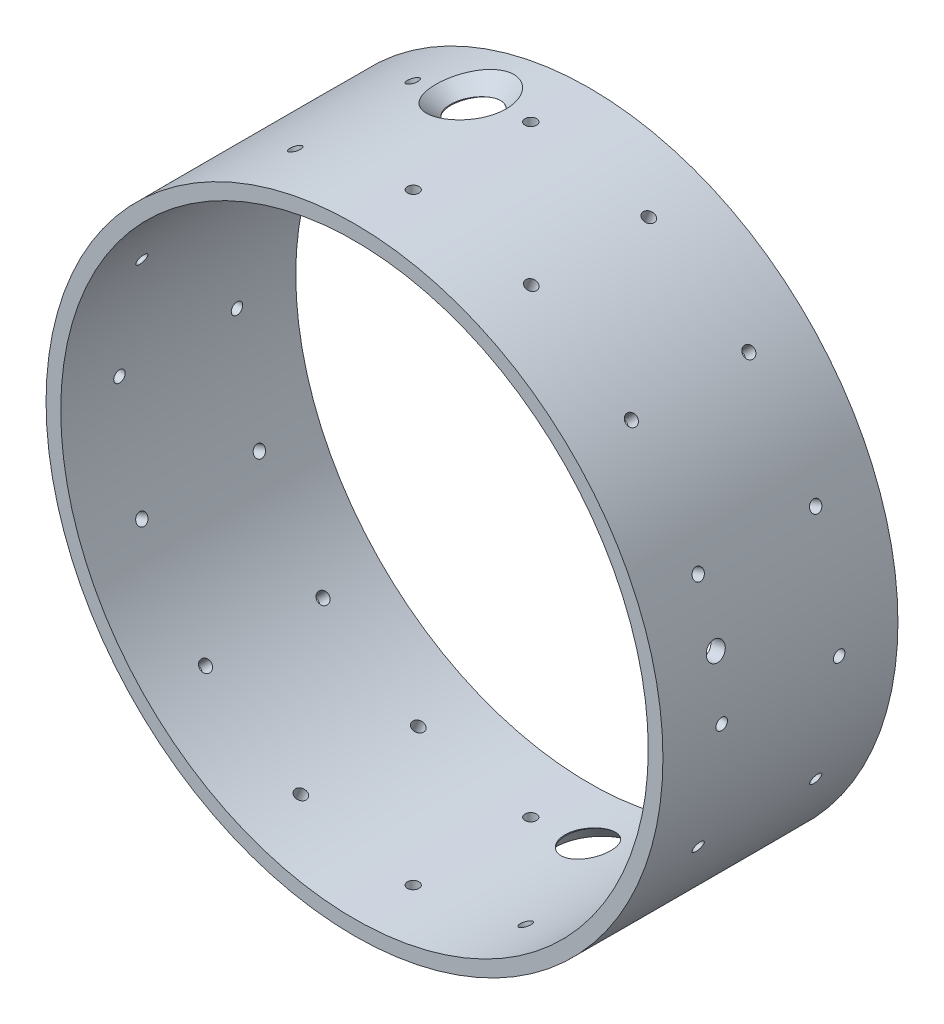
from build123d import *
from build123d.topology import SkipClean

# Parameters (mm, degrees)
SKETCH1_R                            = 66.675
SKETCH1_R_2                          = 63.5
EXTRUDE1_DEPTH                       = 50.8
F_40_0_098_DIAMETER_HOLE2_AT_2_COUNT = 2
F_40_0_098_DIAMETER_HOLE2_AT_2_PITCH = 25.4
CIRPATTERN1_COUNT                    = 16
F_10_32_TAPPED_HOLE1_D               = 4.0386
F_10_32_TAPPED_HOLE1_DEPTH           = 13.716
F_10_32_TAPPED_HOLE1_TIP             = 1.213317848


with BuildPart() as part:
    # Sketch1 → Extrude1 (new body)
    with BuildSketch(Plane.XY):
        Circle(SKETCH1_R)
        Circle(SKETCH1_R_2, mode=Mode.SUBTRACT)
    extrude(amount=EXTRUDE1_DEPTH)

    # Sketch8 → #40 (0.098) Diameter Hole2 (revolve, cut)
    with BuildSketch(Plane(origin=(0, 66.675, 12.7), x_dir=(0, 0, 1), z_dir=(1, 0, 0))):
        Polygon((0, 0), (0, 13.447831126), (1.2446, 12.7), (1.2446, 0), align=None)
    f_40_0_098_diameter_hole2 = revolve(axis=Axis((0, 73.025, 12.7), (0, -1, 0)), mode=Mode.SUBTRACT)

    # #40 (0.098) Diameter Hole2 at 2: #40 (0.098) Diameter Hole2 ×2
    with Locations(*[(0, 0, i * F_40_0_098_DIAMETER_HOLE2_AT_2_PITCH) for i in range(1, F_40_0_098_DIAMETER_HOLE2_AT_2_COUNT)]):
        add(f_40_0_098_diameter_hole2, mode=Mode.SUBTRACT)

    # CirPattern1: #40 (0.098) Diameter Hole2 ×16 about axis
    cirpattern1_axis = Axis((0, 0, 50.8), (0, 0, -1))
    for i in range(1, CIRPATTERN1_COUNT):
        add(f_40_0_098_diameter_hole2.rotate(cirpattern1_axis, i * 360 / CIRPATTERN1_COUNT), mode=Mode.SUBTRACT)

    # CirPattern1 copy 1 sketch → CirPattern1 copy 1 (revolve, cut)
    with BuildSketch(Plane(origin=(25.515417853, 61.59966783, 38.1), x_dir=(0, 0, 1), z_dir=(0.9238795325112867, -0.3826834323650898, 0))):
        Polygon((0, 0), (0, 13.447831126), (1.2446, 12.7), (1.2446, 0), align=None)
    revolve(axis=Axis((27.945457648, 67.466302862, 38.1), (-0.3826834323650898, -0.9238795325112867, 0)), mode=Mode.SUBTRACT)

    # CirPattern1 copy 2 sketch → CirPattern1 copy 2 (revolve, cut)
    with BuildSketch(Plane(origin=(47.146344636, 47.146344636, 38.1), x_dir=(0, 0, 1), z_dir=(0.7071067811865476, -0.7071067811865475, 0))):
        Polygon((0, 0), (0, 13.447831126), (1.2446, 12.7), (1.2446, 0), align=None)
    revolve(axis=Axis((51.636472696, 51.636472696, 38.1), (-0.7071067811865475, -0.7071067811865476, 0)), mode=Mode.SUBTRACT)

    # CirPattern1 copy 3 sketch → CirPattern1 copy 3 (revolve, cut)
    with BuildSketch(Plane(origin=(61.59966783, 25.515417853, 38.1), x_dir=(0, 0, 1), z_dir=(0.38268343236508984, -0.9238795325112867, 0))):
        Polygon((0, 0), (0, 13.447831126), (1.2446, 12.7), (1.2446, 0), align=None)
    revolve(axis=Axis((67.466302862, 27.945457648, 38.1), (-0.9238795325112867, -0.38268343236508984, 0)), mode=Mode.SUBTRACT)

    # CirPattern1 copy 4 sketch → CirPattern1 copy 4 (revolve, cut)
    with BuildSketch(Plane(origin=(66.675, 0, 38.1), x_dir=(0, 0, 1), z_dir=(0, -1, 0))):
        Polygon((0, 0), (0, 13.447831126), (1.2446, 12.7), (1.2446, 0), align=None)
    revolve(axis=Axis((73.025, 0, 38.1), (-1, 0, 0)), mode=Mode.SUBTRACT)

    # CirPattern1 copy 5 sketch → CirPattern1 copy 5 (revolve, cut)
    with BuildSketch(Plane(origin=(61.59966783, -25.515417853, 38.1), x_dir=(0, 0, 1), z_dir=(-0.3826834323650897, -0.9238795325112867, 0))):
        Polygon((0, 0), (0, 13.447831126), (1.2446, 12.7), (1.2446, 0), align=None)
    revolve(axis=Axis((67.466302862, -27.945457648, 38.1), (-0.9238795325112867, 0.3826834323650897, 0)), mode=Mode.SUBTRACT)

    # CirPattern1 copy 6 sketch → CirPattern1 copy 6 (revolve, cut)
    with BuildSketch(Plane(origin=(47.146344636, -47.146344636, 38.1), x_dir=(0, 0, 1), z_dir=(-0.7071067811865475, -0.7071067811865476, 0))):
        Polygon((0, 0), (0, 13.447831126), (1.2446, 12.7), (1.2446, 0), align=None)
    revolve(axis=Axis((51.636472696, -51.636472696, 38.1), (-0.7071067811865476, 0.7071067811865475, 0)), mode=Mode.SUBTRACT)

    # CirPattern1 copy 7 sketch → CirPattern1 copy 7 (revolve, cut)
    with BuildSketch(Plane(origin=(25.515417853, -61.59966783, 38.1), x_dir=(0, 0, 1), z_dir=(-0.9238795325112867, -0.3826834323650899, 0))):
        Polygon((0, 0), (0, 13.447831126), (1.2446, 12.7), (1.2446, 0), align=None)
    revolve(axis=Axis((27.945457648, -67.466302862, 38.1), (-0.3826834323650899, 0.9238795325112867, 0)), mode=Mode.SUBTRACT)

    # CirPattern1 copy 8 sketch → CirPattern1 copy 8 (revolve, cut)
    with BuildSketch(Plane(origin=(0, -66.675, 38.1), x_dir=(0, 0, 1), z_dir=(-1, 0, 0))):
        Polygon((0, 0), (0, 13.447831126), (1.2446, 12.7), (1.2446, 0), align=None)
    revolve(axis=Axis((0, -73.025, 38.1), (0, 1, 0)), mode=Mode.SUBTRACT)

    # CirPattern1 copy 9 sketch → CirPattern1 copy 9 (revolve, cut)
    with BuildSketch(Plane(origin=(-25.515417853, -61.59966783, 38.1), x_dir=(0, 0, 1), z_dir=(-0.9238795325112868, 0.38268343236508967, 0))):
        Polygon((0, 0), (0, 13.447831126), (1.2446, 12.7), (1.2446, 0), align=None)
    revolve(axis=Axis((-27.945457648, -67.466302862, 38.1), (0.38268343236508967, 0.9238795325112868, 0)), mode=Mode.SUBTRACT)

    # CirPattern1 copy 10 sketch → CirPattern1 copy 10 (revolve, cut)
    with BuildSketch(Plane(origin=(-47.146344636, -47.146344636, 38.1), x_dir=(0, 0, 1), z_dir=(-0.7071067811865477, 0.7071067811865475, 0))):
        Polygon((0, 0), (0, 13.447831126), (1.2446, 12.7), (1.2446, 0), align=None)
    revolve(axis=Axis((-51.636472696, -51.636472696, 38.1), (0.7071067811865475, 0.7071067811865477, 0)), mode=Mode.SUBTRACT)

    # CirPattern1 copy 11 sketch → CirPattern1 copy 11 (revolve, cut)
    with BuildSketch(Plane(origin=(-61.59966783, -25.515417853, 38.1), x_dir=(0, 0, 1), z_dir=(-0.3826834323650895, 0.9238795325112868, 0))):
        Polygon((0, 0), (0, 13.447831126), (1.2446, 12.7), (1.2446, 0), align=None)
    revolve(axis=Axis((-67.466302862, -27.945457648, 38.1), (0.9238795325112868, 0.3826834323650895, 0)), mode=Mode.SUBTRACT)

    # CirPattern1 copy 12 sketch → CirPattern1 copy 12 (revolve, cut)
    with BuildSketch(Plane(origin=(-66.675, 0, 38.1), x_dir=(0, 0, 1), z_dir=(0, 1, 0))):
        Polygon((0, 0), (0, 13.447831126), (1.2446, 12.7), (1.2446, 0), align=None)
    revolve(axis=Axis((-73.025, 0, 38.1), (1, 0, 0)), mode=Mode.SUBTRACT)

    # CirPattern1 copy 13 sketch → CirPattern1 copy 13 (revolve, cut)
    with BuildSketch(Plane(origin=(-61.59966783, 25.515417853, 38.1), x_dir=(0, 0, 1), z_dir=(0.38268343236509, 0.9238795325112866, 0))):
        Polygon((0, 0), (0, 13.447831126), (1.2446, 12.7), (1.2446, 0), align=None)
    revolve(axis=Axis((-67.466302862, 27.945457648, 38.1), (0.9238795325112866, -0.38268343236509, 0)), mode=Mode.SUBTRACT)

    # CirPattern1 copy 14 sketch → CirPattern1 copy 14 (revolve, cut)
    with BuildSketch(Plane(origin=(-47.146344636, 47.146344636, 38.1), x_dir=(0, 0, 1), z_dir=(0.7071067811865474, 0.7071067811865477, 0))):
        Polygon((0, 0), (0, 13.447831126), (1.2446, 12.7), (1.2446, 0), align=None)
    revolve(axis=Axis((-51.636472696, 51.636472696, 38.1), (0.7071067811865477, -0.7071067811865474, 0)), mode=Mode.SUBTRACT)

    # CirPattern1 copy 15 sketch → CirPattern1 copy 15 (revolve, cut)
    with BuildSketch(Plane(origin=(-25.515417853, 61.59966783, 38.1), x_dir=(0, 0, 1), z_dir=(0.9238795325112868, 0.38268343236508956, 0))):
        Polygon((0, 0), (0, 13.447831126), (1.2446, 12.7), (1.2446, 0), align=None)
    revolve(axis=Axis((-27.945457648, 67.466302862, 38.1), (0.38268343236508956, -0.9238795325112868, 0)), mode=Mode.SUBTRACT)

    # Sketch14 → 3/8 Clearance Hole1 (revolve, cut)
    with SkipClean():  # the faces are left unmerged after this step: merging them gives an invalid solid
        with BuildSketch(Plane(origin=(-13.00764722, 65.393858571, 12.7), x_dir=(-0.9807852804032303, -0.19509032201612872, 0), z_dir=(0, 0, 1))):
            Polygon((0, 0), (0, 15.983479155), (5.0419, 12.954), (5.0419, 3.175), (8.2169, 0), align=None)
        f_3_8_clearance_hole1 = revolve(axis=Axis((-14.246470765, 71.621845101, 12.7), (0.19509032201612872, -0.9807852804032303, 0)), mode=Mode.SUBTRACT)

    # Mirror1: 3/8 Clearance Hole1 across plane
    with SkipClean():  # the faces are left unmerged after this step: merging them gives an invalid solid
        add(f_3_8_clearance_hole1.mirror(Plane(origin=(0, 0, 12.7), x_dir=(0, 0, 1), z_dir=(-0.19509032201612872, 0.9807852804032303, 0))), mode=Mode.SUBTRACT)

    # #10-32 Tapped Hole1
    with Locations(Plane(origin=(65.393858571, 13.00764722, 12.7), x_dir=(0, 0, -1), z_dir=(0.9807852804032311, 0.19509032201612506, 0))):
        with Locations((-25.4, 0)):
            Hole(F_10_32_TAPPED_HOLE1_D / 2, depth=F_10_32_TAPPED_HOLE1_DEPTH)
            with Locations((0, 0, -(F_10_32_TAPPED_HOLE1_DEPTH + F_10_32_TAPPED_HOLE1_TIP / 2))):  # 118° drill point
                Cone(0, F_10_32_TAPPED_HOLE1_D / 2, F_10_32_TAPPED_HOLE1_TIP, mode=Mode.SUBTRACT)


solid = part.part
